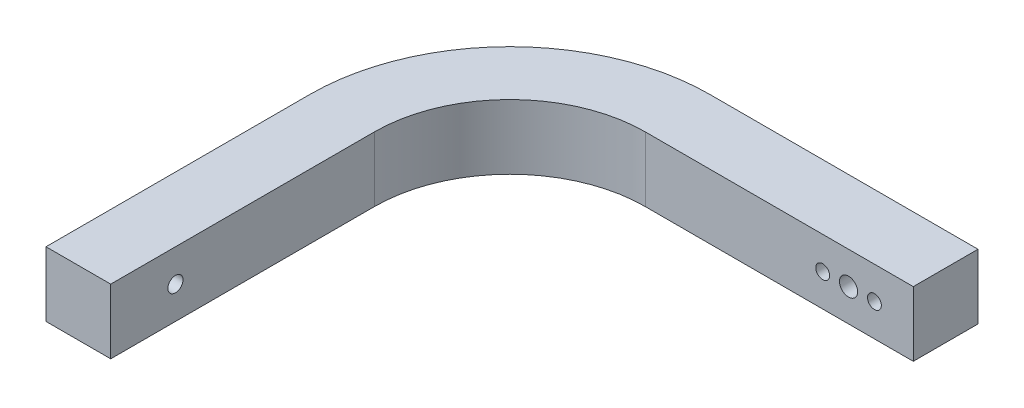
from build123d import *

# Parameters (mm, degrees)
BOSS_EXTRUDE1_DEPTH      = 7.5
BOSS_EXTRUDE1_DEPTH_BACK = 7.5
CUT_EXTRUDE1_DEPTH       = 143.670073947
CUT_EXTRUDE1_DEPTH_BACK  = 143.670073947
SKETCH2_R                = 1.75
SKETCH3_R                = 2.1
SKETCH3_R_2              = 1.6
CUT_EXTRUDE2_DEPTH       = 143.670073947
SKETCH4_R                = 2.275
CUT_EXTRUDE3_DEPTH       = 6
SKETCH5_R                = 3.825
CUT_EXTRUDE4_DEPTH       = 0.75


with BuildPart() as part:
    # Sketch1 → Boss-Extrude1 (new, two sides: drawn at the far end of the back side and taken through both)
    with BuildSketch(Plane(origin=(0, 0, 0), x_dir=(1, 0, 0), z_dir=(0, 1, 0)).offset(-BOSS_EXTRUDE1_DEPTH_BACK)):
        with BuildLine():
            Line((-93.5, -46.4), (-93.5, -107.5))
            Line((-93.5, -107.5), (-78.5, -107.5))
            Line((-78.5, -107.5), (-78.5, -46.4))
            ThreePointArc((-78.5, -46.4), (-69.303152929, -24.196847071), (-47.1, -15))
            Line((-47.1, -15), (15, -15))
            Line((15, -15), (15, 0))
            Line((15, 0), (-47.1, 0))
            ThreePointArc((-47.1, 0), (-79.909754647, -13.590245353), (-93.5, -46.4))
        make_face()
    extrude(amount=BOSS_EXTRUDE1_DEPTH + BOSS_EXTRUDE1_DEPTH_BACK)

    # Sketch2 → Cut-Extrude1 (cut, two sides: drawn at the far end of the back side and taken through both)
    with BuildSketch(Plane.ZY.offset(78.5).offset(-CUT_EXTRUDE1_DEPTH_BACK)):
        with Locations((92.5, 0)):
            Circle(SKETCH2_R)
    extrude(amount=CUT_EXTRUDE1_DEPTH + CUT_EXTRUDE1_DEPTH_BACK, mode=Mode.SUBTRACT)

    # Sketch3 → Cut-Extrude2 (cut, through all)
    with BuildSketch(Plane(origin=(0, 0, 0), x_dir=(-1, 0, 0), z_dir=(0, 0, -1))):
        Circle(SKETCH3_R)
        with Locations((-6, 0)):
            Circle(SKETCH3_R_2)
        with Locations((6, 0)):
            Circle(SKETCH3_R_2)
    extrude(amount=-CUT_EXTRUDE2_DEPTH, mode=Mode.SUBTRACT)

    # Sketch4 → Cut-Extrude3 (cut)
    with BuildSketch(Plane(origin=(-93.5, 0, 0), x_dir=(0, 0, -1), z_dir=(1, 0, 0))):
        with Locations((-92.5, 0)):
            Circle(SKETCH4_R)
    extrude(amount=CUT_EXTRUDE3_DEPTH, mode=Mode.SUBTRACT)

    # Sketch5 → Cut-Extrude4 (cut)
    with BuildSketch(Plane.ZY.offset(93.5)):
        with Locations((92.5, 0)):
            Circle(SKETCH5_R)
    extrude(amount=-CUT_EXTRUDE4_DEPTH, mode=Mode.SUBTRACT)


solid = part.part
